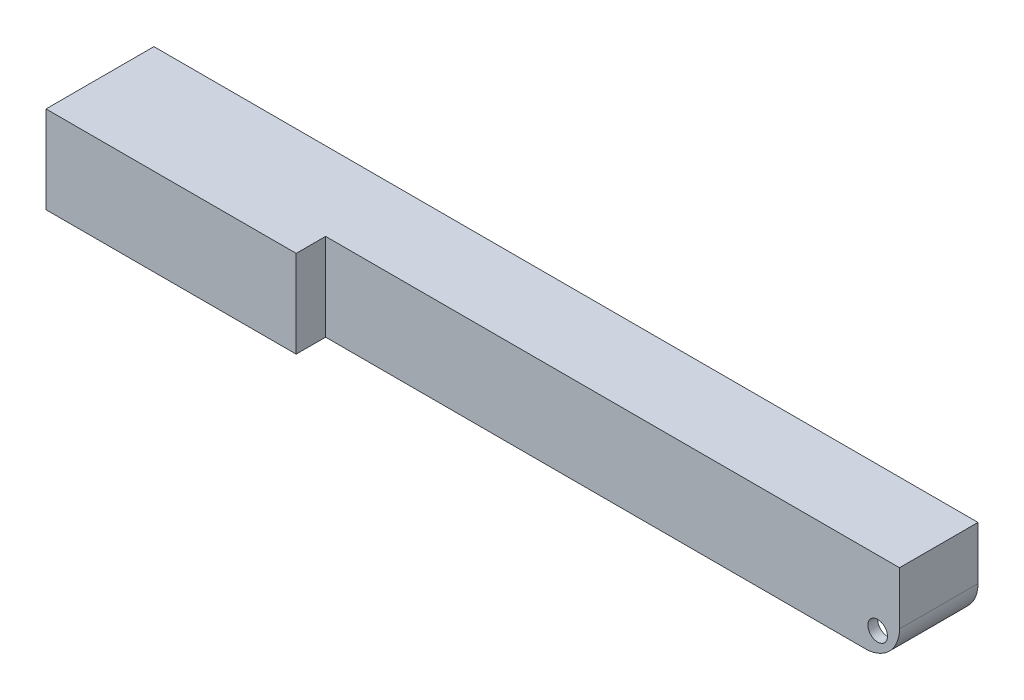
from build123d import *

# Parameters (mm, degrees)
SKETCH1_W           = 168
SKETCH1_H           = 22
BOSS_EXTRUDE1_DEPTH = 17.8
SKETCH8_R           = 2
CUT_EXTRUDE4_DEPTH  = 22
CUT_EXTRUDE2_REACH  = 88.567
SKETCH5_W           = 117
SKETCH5_H           = 6
CUT_EXTRUDE3_DEPTH  = 15.8
BOSS_EXTRUDE2_REACH = 90.164
SKETCH9_W           = 47
SKETCH9_H           = 2
FILLET1_R           = 7


with BuildPart() as part:
    # Sketch1 → Boss-Extrude1 (new body)
    with BuildSketch(Plane(origin=(0, 0, 0), x_dir=(1, 0, 0), z_dir=(0, 1, 0))):
        Rectangle(SKETCH1_W, SKETCH1_H)
    extrude(amount=-BOSS_EXTRUDE1_DEPTH)

    # Sketch8 → Cut-Extrude4 (cut)
    with BuildSketch(Plane.XY.offset(11)):
        with Locations((79.55, -13.35)):
            Circle(SKETCH8_R)
    extrude(amount=-CUT_EXTRUDE4_DEPTH, mode=Mode.SUBTRACT)

    # Cut-Extrude2: up to this face of the body (flat: up to its plane)
    cut_extrude2_end = Plane(part.part.faces().sort_by_distance((0, -17.8, 0))[0])
    # Sketch5 → Cut-Extrude2 (cut, up to the picked face)
    with BuildSketch(Plane(origin=(0, 0, 0), x_dir=(1, 0, 0), z_dir=(0, 1, 0)), mode=Mode.PRIVATE) as cut_extrude2_sk1:
        with Locations((25.5, -8)):
            Rectangle(SKETCH5_W, SKETCH5_H)
    cut_extrude2_tool1 = split(extrude(cut_extrude2_sk1.sketch, amount=-CUT_EXTRUDE2_REACH, mode=Mode.PRIVATE), bisect_by=cut_extrude2_end, keep=Keep.BOTH, mode=Mode.PRIVATE)
    add(cut_extrude2_tool1.solids().sort_by(Axis((25.5, 0, 8), (0, -1, 0)))[0], mode=Mode.SUBTRACT)

    # Sketch6 → Cut-Extrude3 (cut)
    with BuildSketch(Plane.XZ.offset(17.8)):
        Polygon((-82, 9), (-82, -9), (82, -9), (82, 3), (-35, 3), (-35, 9), align=None)
    extrude(amount=-CUT_EXTRUDE3_DEPTH, mode=Mode.SUBTRACT)

    # Boss-Extrude2: up to this face of the body (flat: up to its plane)
    boss_extrude2_end = Plane(part.part.faces().sort_by_distance((-0.387668404, -9.883187228, -9))[0])
    # Sketch9 → Boss-Extrude2 (add, up to the picked face)
    with BuildSketch(Plane(origin=(0, 0, 9), x_dir=(-1, 0, 0), z_dir=(0, 0, -1)), mode=Mode.PRIVATE) as boss_extrude2_sk1:
        with Locations((58.5, -13.3)):
            Rectangle(SKETCH9_W, SKETCH9_H)
    boss_extrude2_tool1 = split(extrude(boss_extrude2_sk1.sketch, amount=BOSS_EXTRUDE2_REACH, mode=Mode.PRIVATE), bisect_by=boss_extrude2_end, keep=Keep.BOTH, mode=Mode.PRIVATE)
    add(boss_extrude2_tool1.solids().sort_by(Axis((-58.5, -13.3, 9), (0, 0, -1)))[0])

    # Fillet1
    # the kernel refuses this fillet: 7 mm, written as the material it takes off along each edge
    with BuildSketch(Plane(origin=(84, -17.8, 22.5), x_dir=(-1, 0, 0), z_dir=(0, 0, -1))) as fillet1_piece_1:
        with BuildLine():
            CenterArc((FILLET1_R, FILLET1_R), FILLET1_R, 180, 90)
            Line((0, FILLET1_R), (0, 0))
            Line((0, 0), (FILLET1_R, 0))
        make_face()
    extrude(amount=51, mode=Mode.SUBTRACT)


solid = part.part
